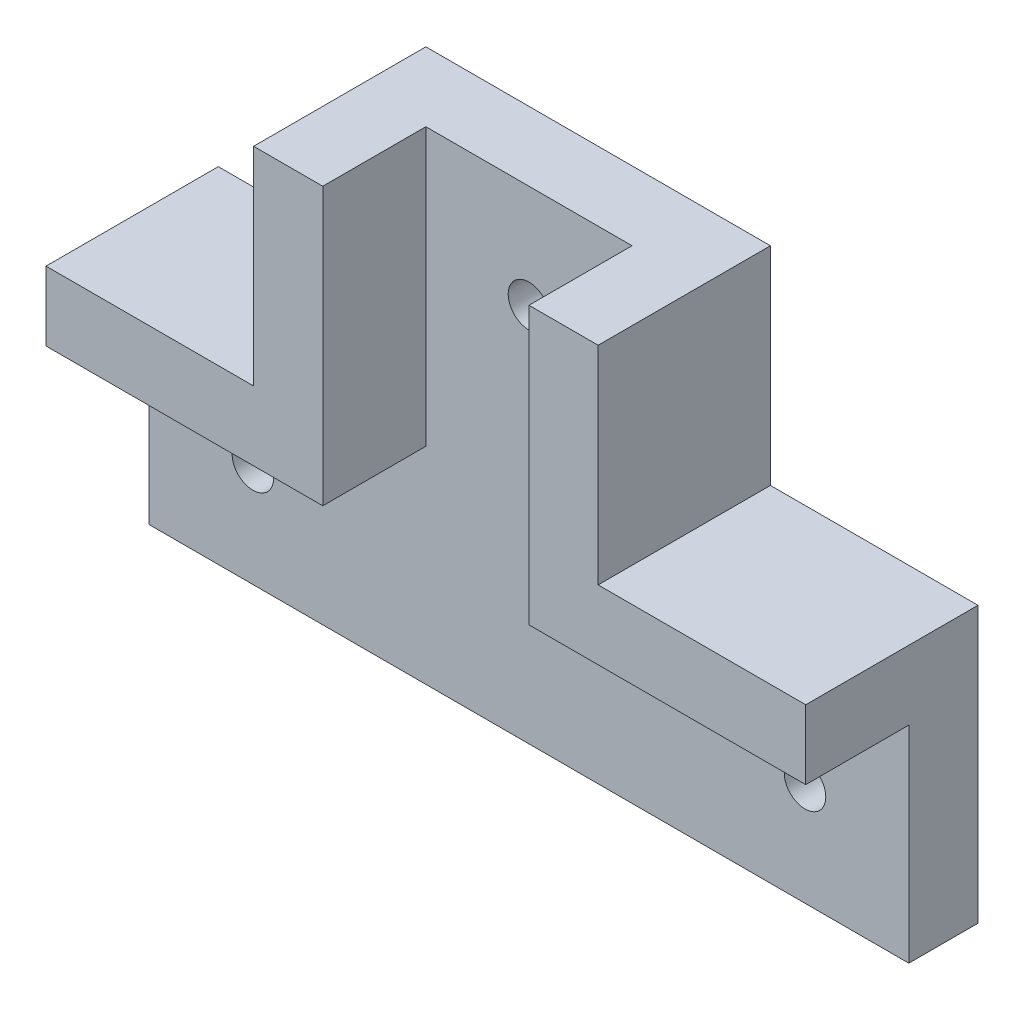
from build123d import *

# Parameters (mm, degrees)
BOSS_EXTRUDE1_DEPTH = 5
BOSS_EXTRUDE2_DEPTH = 12.45
SKETCH6_R           = 1.5
CUT_EXTRUDE3_DEPTH  = 40.917007196


with BuildPart() as part:
    # Sketch1 → Boss-Extrude1 (new body)
    with BuildSketch(Plane.XY):
        Polygon((14.21372549, -4.264705882), (34.21372549, -4.264705882), (34.21372549, -19.164705882), (-20.68627451, -19.164705882), (-20.68627451, -4.264705882), (-0.68627451, -4.264705882), (-0.68627451, 15.735294118), (14.21372549, 15.735294118), align=None)
    extrude(amount=BOSS_EXTRUDE1_DEPTH)

    # Sketch2 → Boss-Extrude2 (add)
    with BuildSketch(Plane(origin=(0, 0, 0), x_dir=(-1, 0, 0), z_dir=(0, 0, -1))):
        Polygon((0.68627451, 15.735294118), (5.68627451, 15.735294118), (5.68627451, 0.735294118), (6.079970528, 0.735294118), (20.68627451, 0.735294118), (20.68627451, -4.264705882), (0.68627451, -4.264705882), align=None)
    boss_extrude2 = extrude(amount=-BOSS_EXTRUDE2_DEPTH)

    # Mirror1: Boss-Extrude2 across plane
    add(boss_extrude2.mirror(Plane.ZY.offset(-6.76372549)))

    # Sketch6 → Cut-Extrude3 (cut, through all)
    with BuildSketch(Plane.XY.offset(5)):
        with Locations((6.76372549, 8.235294118)):
            Circle(SKETCH6_R)
        with Locations((-13.18627451, -11.764705882)):
            Circle(SKETCH6_R)
        with Locations((26.71372549, -11.764705882)):
            Circle(SKETCH6_R)
    extrude(amount=-CUT_EXTRUDE3_DEPTH, mode=Mode.SUBTRACT)


solid = part.part
